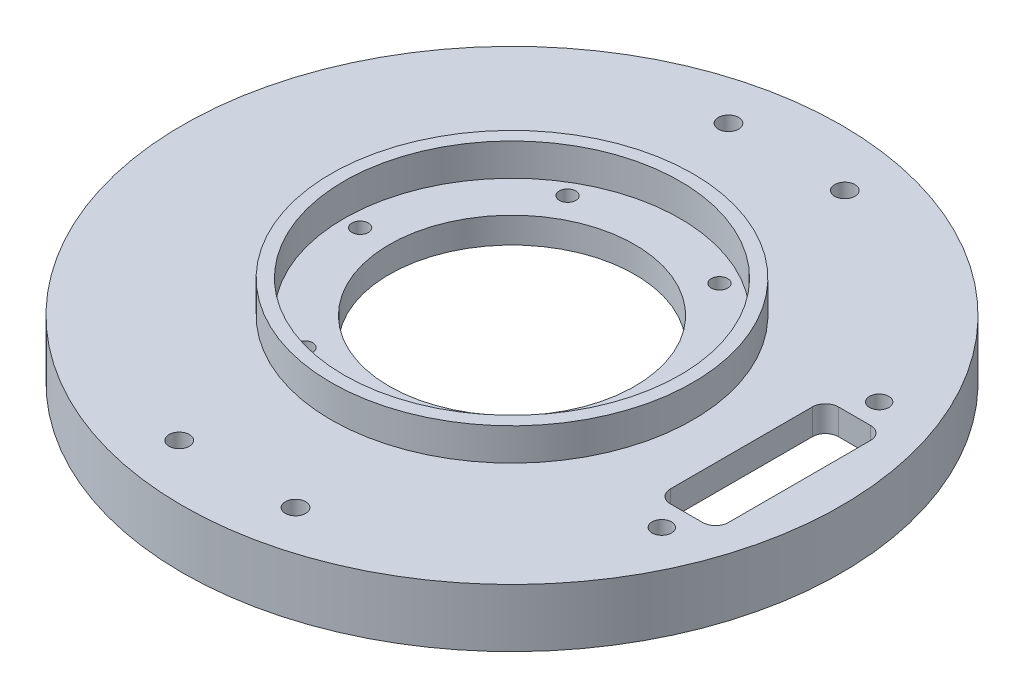
from build123d import *

# Parameters (mm, degrees)
SKETCH_1_R                  = 51
SKETCH_1_R_2                = 19
EXTRUDE_1_DEPTH             = 4
PATTERN_CIRCULAR_1_COUNT    = 6
HOLE_WIZARD_M32_D           = 3.15
PATTERN_LINEAR_1_COUNT      = 2
PATTERN_LINEAR_1_PITCH      = 18
PATTERN_LINEAR_1_COUNT_DIR2 = 2
PATTERN_LINEAR_1_PITCH_DIR2 = 85
SKETCH_14_R                 = 28
SKETCH_14_R_2               = 26
EXTRUDE_2_DEPTH             = 5
EXTRUDE_START               = 5
SKETCH_15_R                 = 51
SKETCH_15_R_2               = 48
EXTRUDE_3_DEPTH             = 5
SKETCH_16_R                 = 1.5
SKETCH_16_W                 = 9
SKETCH_16_H                 = 26
CUT_EXTRUDE_1_DEPTH         = 73.684248638
FILLET_1_R                  = 2


with BuildPart() as part:
    # Эскиз1 → Бобышка-Вытянуть1 (new body)
    with BuildSketch(Plane(origin=(0, 0, 0), x_dir=(1, 0, 0), z_dir=(0, 1, 0))):
        Circle(SKETCH_1_R)
        Circle(SKETCH_1_R_2, mode=Mode.SUBTRACT)
    extrude(amount=EXTRUDE_1_DEPTH)

    # Эскиз3 → Сверло под метчик  спиральное M2.51 (revolve, cut)
    with BuildSketch(Plane(origin=(23.5, 4, 0), x_dir=(0, 0, 1), z_dir=(1, 0, 0))):
        Polygon((0, 0), (0, 8.766097289), (1.275, 8), (1.275, 0), align=None)
    hole_wizard_m2_51 = revolve(axis=Axis((23.5, 10.35, 0), (0, -1, 0)), mode=Mode.SUBTRACT)

    # Круговой массив1: Сверло под метчик  спиральное M2.51 ×6 about axis
    pattern_circular_1_axis = Axis((0, 4, 0), (0, 1, 0))
    for i in range(1, PATTERN_CIRCULAR_1_COUNT):
        add(hole_wizard_m2_51.rotate(pattern_circular_1_axis, i * 360 / PATTERN_CIRCULAR_1_COUNT), mode=Mode.SUBTRACT)

    # Сверло под метчик  спиральное M32 (through all)
    with Locations(Plane(origin=(0, 0, 0), x_dir=(-1, 0, 0), z_dir=(0, -1, 0))):
        with Locations((-9, -42.5)):
            hole_wizard_m32 = Hole(HOLE_WIZARD_M32_D / 2)

    # Линейный массив1: Hole Wizard M32 2 × 2
    with Locations(*[(-i * PATTERN_LINEAR_1_PITCH, 0, -j * PATTERN_LINEAR_1_PITCH_DIR2) for i in range(PATTERN_LINEAR_1_COUNT) for j in range(PATTERN_LINEAR_1_COUNT_DIR2) if (i, j) != (0, 0)]):
        add(hole_wizard_m32, mode=Mode.SUBTRACT)

    # Эскиз14 → Бобышка-Вытянуть2 (add)
    with BuildSketch(Plane(origin=(0, 4, 0), x_dir=(1, 0, 0), z_dir=(0, 1, 0))):
        Circle(SKETCH_14_R)
        Circle(SKETCH_14_R_2, mode=Mode.SUBTRACT)
    extrude(amount=EXTRUDE_2_DEPTH)

    # Эскиз15 → Бобышка-Вытянуть3 (add)
    with BuildSketch(Plane.XZ.offset(EXTRUDE_START)):
        Circle(SKETCH_15_R)
        Circle(SKETCH_15_R_2, mode=Mode.SUBTRACT)
    extrude(amount=-EXTRUDE_3_DEPTH)

    # Эскиз16 → Вырез-Вытянуть1 (cut, through all)
    with BuildSketch(Plane(origin=(0, 4, 0), x_dir=(1, 0, 0), z_dir=(0, 1, 0))):
        with Locations((40, 16.82)):
            Circle(SKETCH_16_R)
        with Locations((40, -16.82)):
            Circle(SKETCH_16_R)
        with Locations((40, 0)):
            Rectangle(SKETCH_16_W, SKETCH_16_H)
    extrude(amount=-CUT_EXTRUDE_1_DEPTH, mode=Mode.SUBTRACT)

    # Скругление1
    fillet_1_edges = [part.edges().sort_by_distance(p)[0] for p in [
        (44.5, 2, 13),
        (35.5, 2, 13),
        (44.5, 2, -13),
        (35.5, 2, -13),
    ]]
    fillet(fillet_1_edges, radius=FILLET_1_R)


solid = part.part
